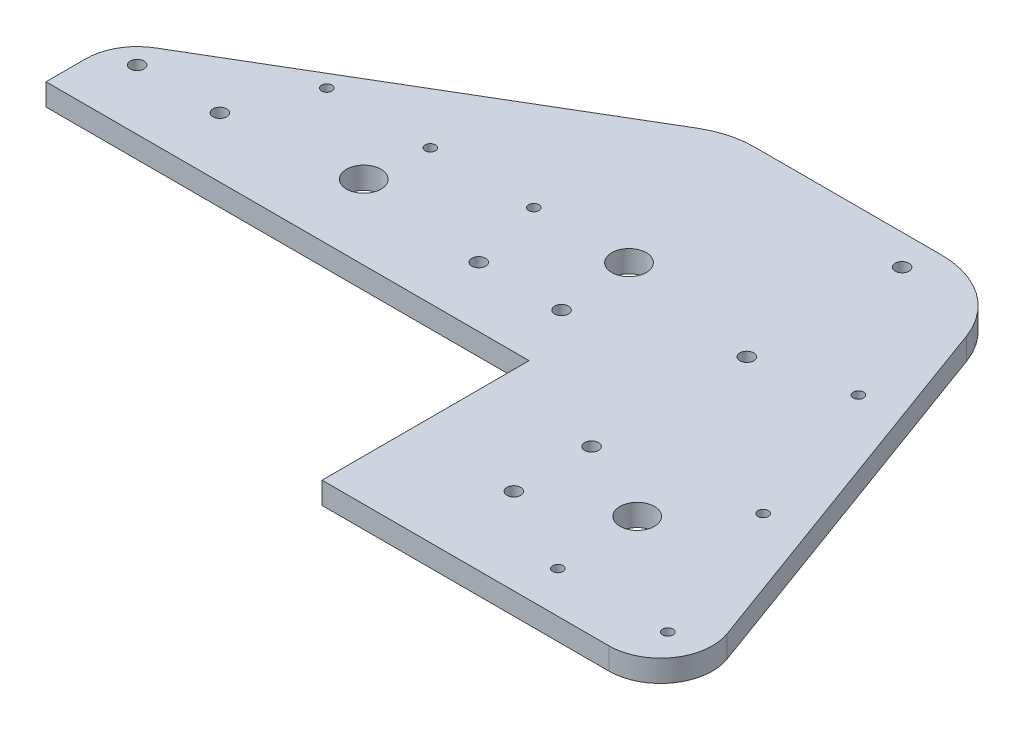
from build123d import *

# Parameters (mm, degrees)
SKETCH1_R           = 5
BOSS_EXTRUDE2_DEPTH = 6.35
SKETCH3_R           = 1.5
CUT_EXTRUDE1_DEPTH  = 6.35
SKETCH4_R           = 2
CUT_EXTRUDE2_DEPTH  = 10
SKETCH6_R           = 2
CUT_EXTRUDE3_DEPTH  = 6.35
FILLET16_R          = 15
CUT_EXTRUDE6_DEPTH  = 10
SKETCH13_R          = 2
CUT_EXTRUDE8_DEPTH  = 10
FILLET31_R          = 25.4


with BuildPart() as part:
    # Sketch1 → Boss-Extrude2 (new body)
    with BuildSketch(Plane(origin=(0, 0, 0), x_dir=(1, 0, 0), z_dir=(0, 1, 0))):
        Polygon((180.6, 175), (160.6, 175), (0, 80), (0, 60), (70.5, 60), (140, 60), (140, 0), (194.75, 0), (244.6, 0), align=None)
        with Locations((194.75, 36.59)):
            Circle(SKETCH1_R, mode=Mode.SUBTRACT)
        with BuildLine():
            ThreePointArc((75.5, 81.59), (74.035533906, 78.054466094), (70.5, 76.59))
            ThreePointArc((70.5, 76.59), (66.964466094, 85.125533906), (75.5, 81.59))
        make_face(mode=Mode.SUBTRACT)
        with Locations((129.875, 99.09)):
            Circle(SKETCH1_R, mode=Mode.SUBTRACT)
    extrude(amount=BOSS_EXTRUDE2_DEPTH)

    # Sketch3 → Cut-Extrude1 (cut)
    with BuildSketch(Plane(origin=(0, 6.35, 0), x_dir=(1, 0, 0), z_dir=(0, 1, 0))):
        with Locations((42.27958751, 99.09440108)):
            Circle(SKETCH3_R)
        with Locations((196.359761891, 12)):
            Circle(SKETCH3_R)
        with Locations((228.211428571, 12)):
            Circle(SKETCH3_R)
        with Locations((212.285595231, 55.54720054)):
            Circle(SKETCH3_R)
        with Locations((196.359761891, 99.09440108)):
            Circle(SKETCH3_R)
        with Locations((102.27958751, 99.09440108)):
            Circle(SKETCH3_R)
        with Locations((72.27958751, 99.09440108)):
            Circle(SKETCH3_R)
    extrude(amount=-CUT_EXTRUDE1_DEPTH, mode=Mode.SUBTRACT)

    # Sketch4 → Cut-Extrude2 (cut)
    with BuildSketch(Plane(origin=(0, 6.35, 0), x_dir=(1, 0, 0), z_dir=(0, 1, 0))):
        with Locations((170.6, 160)):
            Circle(SKETCH4_R)
        with Locations((170.6, 25)):
            Circle(SKETCH4_R)
        with Locations((170.6, 47.5)):
            Circle(SKETCH4_R)
        with Locations((170.6, 92.5)):
            Circle(SKETCH4_R)
        with Locations((170.6, 137.5)):
            Circle(SKETCH4_R)
    extrude(amount=-CUT_EXTRUDE2_DEPTH, mode=Mode.SUBTRACT)

    # Sketch6 → Cut-Extrude3 (cut)
    with BuildSketch(Plane(origin=(0, 0, 0), x_dir=(-1, 0, 0), z_dir=(0, -1, 0))):
        with Locations((-132, 77.4)):
            Circle(SKETCH6_R)
        with Locations((-108, 77.4)):
            Circle(SKETCH6_R)
        with Locations((-33, 77.4)):
            Circle(SKETCH6_R)
        with Locations((-9, 77.4)):
            Circle(SKETCH6_R)
    extrude(amount=-CUT_EXTRUDE3_DEPTH, mode=Mode.SUBTRACT)

    # Fillet16
    fillet16_edges = [part.edges().sort_by_distance(p)[0] for p in [
        (244.6, 3.175, 0),
        (180.6, 3.175, -175),
        (0, 3.175, -80),
        (160.6, 3.175, -175),
    ]]
    fillet(fillet16_edges, radius=FILLET16_R)

    # Sketch12 → Cut-Extrude6 (cut)
    with BuildSketch(Plane(origin=(0, 6.35, 0), x_dir=(1, 0, 0), z_dir=(0, 1, 0))):
        with BuildLine():
            Line((138.847744646, 162.132850195), (182.658467011, 198.001504777))
            Line((182.658467011, 198.001504777), (187.233145196, 156.862493604))
            add(Edge.make_bspline(
                [(138.847744646, 162.132850195), (153.766241305, 167.731697506), (175.982996701, 172.361292754), (187.233145196, 156.862493604)],
                knots=[0, 0, 0, 0, 1, 1, 1, 1], degree=3))
        make_face()
    extrude(amount=-CUT_EXTRUDE6_DEPTH, mode=Mode.SUBTRACT)

    # Sketch13 → Cut-Extrude8 (cut)
    with BuildSketch(Plane(origin=(0, 6.35, 0), x_dir=(1, 0, 0), z_dir=(0, 1, 0))):
        with BuildLine():
            Line((138.847744646, 162.132850195), (112.058636218, 146.286241848))
            Line((112.058636218, 146.286241848), (191.101031553, 146.286241848))
            Line((191.101031553, 146.286241848), (187.233145196, 156.862493604))
            add(Edge.make_bspline(
                [(187.233145196, 156.862493604), (175.982996701, 172.361292754), (153.766241305, 167.731697506), (138.847744646, 162.132850195)],
                knots=[0, 0, 0, 0, 1, 1, 1, 1], degree=3))
        make_face()
        with Locations((170.6, 160)):
            Circle(SKETCH13_R, mode=Mode.SUBTRACT)
    extrude(amount=-CUT_EXTRUDE8_DEPTH, mode=Mode.SUBTRACT)

    # Fillet31
    fillet31_edges = [part.edges().sort_by_distance(p)[0] for p in [
        (191.101031553, 3.175, -146.286241848),
        (112.058636218, 3.175, -146.286241848),
    ]]
    fillet(fillet31_edges, radius=FILLET31_R)


solid = part.part
